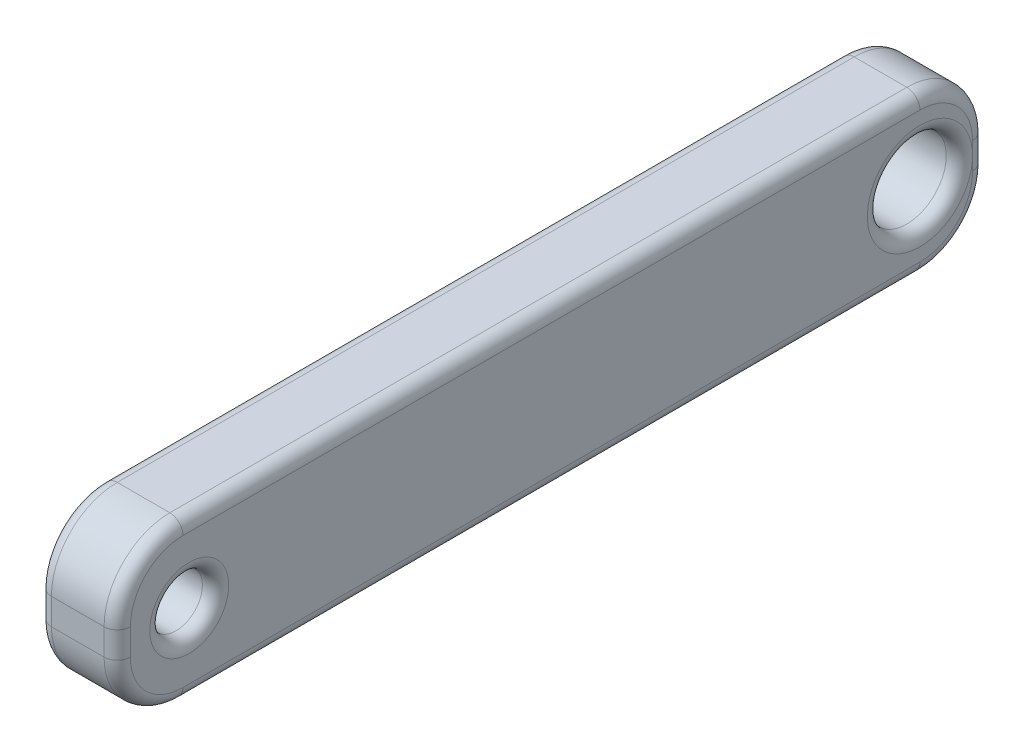
from build123d import *

# Parameters (mm, degrees)
SKETCH1_R           = 1
BOSS_EXTRUDE1_DEPTH = 3
SKETCH2_R           = 1.5
CUT_EXTRUDE1_DEPTH  = 10
FILLET1_R           = 0.5


with BuildPart() as part:
    # Sketch1 → Boss-Extrude1 (new body)
    with BuildSketch(Plane(origin=(0, 0, 0), x_dir=(0, 0, -1), z_dir=(1, 0, 0))):
        with BuildLine():
            Line((2.5, 0), (30.5, 0))
            ThreePointArc((30.5, 0), (32.267766953, 0.732233047), (33, 2.5))
            Line((33, 2.5), (33, 3.5))
            ThreePointArc((33, 3.5), (32.267766953, 5.267766953), (30.5, 6))
            Line((30.5, 6), (2.5, 6))
            ThreePointArc((2.5, 6), (0.732233047, 5.267766953), (0, 3.5))
            Line((0, 3.5), (0, 2.5))
            ThreePointArc((0, 2.5), (0.732233047, 0.732233047), (2.5, 0))
        make_face()
        with Locations((2.73587532, 3)):
            Circle(SKETCH1_R, mode=Mode.SUBTRACT)
    extrude(amount=BOSS_EXTRUDE1_DEPTH)

    # Sketch2 → Cut-Extrude1 (cut)
    with BuildSketch(Plane.ZY):
        with Locations((-30.5, 3)):
            Circle(SKETCH2_R)
    extrude(amount=-CUT_EXTRUDE1_DEPTH, mode=Mode.SUBTRACT)

    # Fillet1
    fillet1_edges = [part.edges().sort_by_distance(p)[0] for p in [
        (3, 5.267766953, -0.732233047),
        (0, 6, -16.5),
        (0, 5.267766953, -32.267766953),
        (3, 3, 0),
        (3, 0.732233047, -0.732233047),
        (3, 0, -16.5),
        (0, 3, -1.73587532),
        (3, 3, -1.73587532),
        (3, 0.732233047, -32.267766953),
        (3, 3, -33),
        (3, 3, -32),
        (0, 3, -32),
        (3, 5.267766953, -32.267766953),
        (3, 6, -16.5),
        (0, 3, -33),
        (0, 0.732233047, -32.267766953),
        (0, 0, -16.5),
        (0, 0.732233047, -0.732233047),
        (0, 3, 0),
        (0, 5.267766953, -0.732233047),
    ]]
    fillet(fillet1_edges, radius=FILLET1_R - 0.0001)  # a hair under: the kernel refuses the full size


solid = part.part
